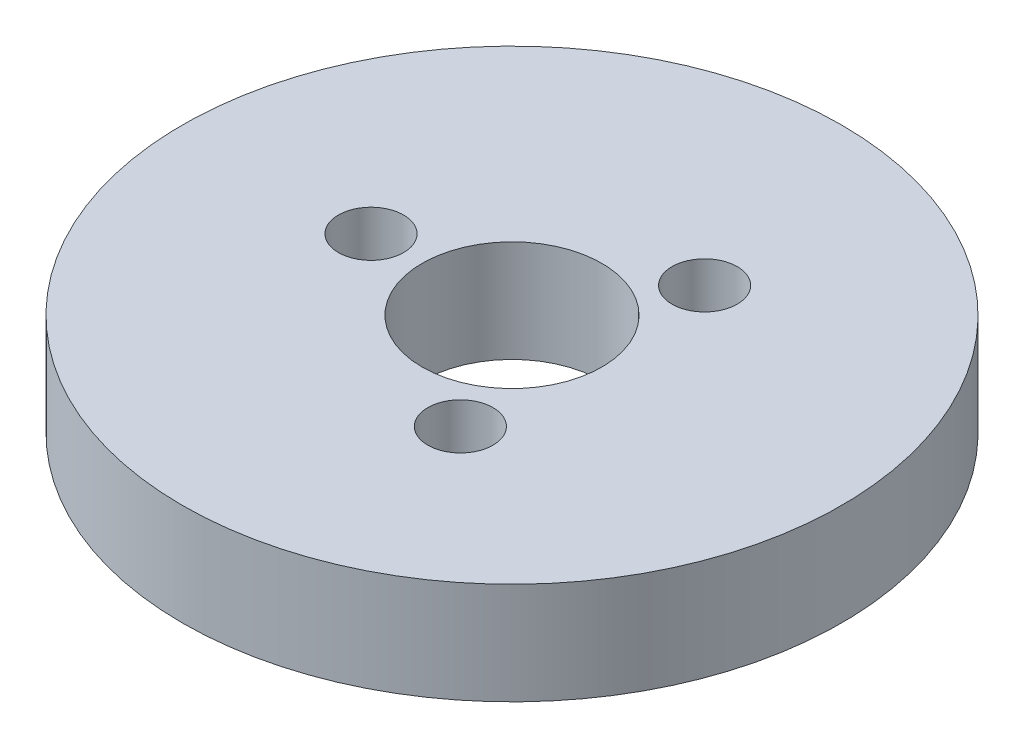
from build123d import *

# Parameters (mm, degrees)
SKETCH1_R           = 55
BOSS_EXTRUDE1_DEPTH = 17
SKETCH2_R           = 15
CUT_EXTRUDE1_DEPTH  = 80.617837197
SKETCH3_R           = 5.440158161
CUT_EXTRUDE2_DEPTH  = 13.157756636
CIRPATTERN1_COUNT   = 3


with BuildPart() as part:
    # Sketch1 → Boss-Extrude1 (new body)
    with BuildSketch(Plane(origin=(0, 0, 0), x_dir=(1, 0, 0), z_dir=(0, 1, 0))):
        Circle(SKETCH1_R)
    extrude(amount=BOSS_EXTRUDE1_DEPTH)

    # Sketch2 → Cut-Extrude1 (cut, through all)
    with BuildSketch(Plane(origin=(0, 0, 0), x_dir=(1, 0, 0), z_dir=(0, 1, 0))):
        Circle(SKETCH2_R)
    extrude(amount=CUT_EXTRUDE1_DEPTH, mode=Mode.SUBTRACT)

    # Sketch3 → Cut-Extrude2 (cut)
    with BuildSketch(Plane(origin=(0, 17, 0), x_dir=(1, 0, 0), z_dir=(0, 1, 0))):
        with Locations((-23.531613664, 0)):
            Circle(SKETCH3_R)
    cut_extrude2 = extrude(amount=-CUT_EXTRUDE2_DEPTH, mode=Mode.SUBTRACT)

    # CirPattern1: Cut-Extrude2 ×3 about axis
    cirpattern1_axis = Axis((0, 0, 0), (0, 1, 0))
    for i in range(1, CIRPATTERN1_COUNT):
        add(cut_extrude2.rotate(cirpattern1_axis, i * 360 / CIRPATTERN1_COUNT), mode=Mode.SUBTRACT)


solid = part.part
